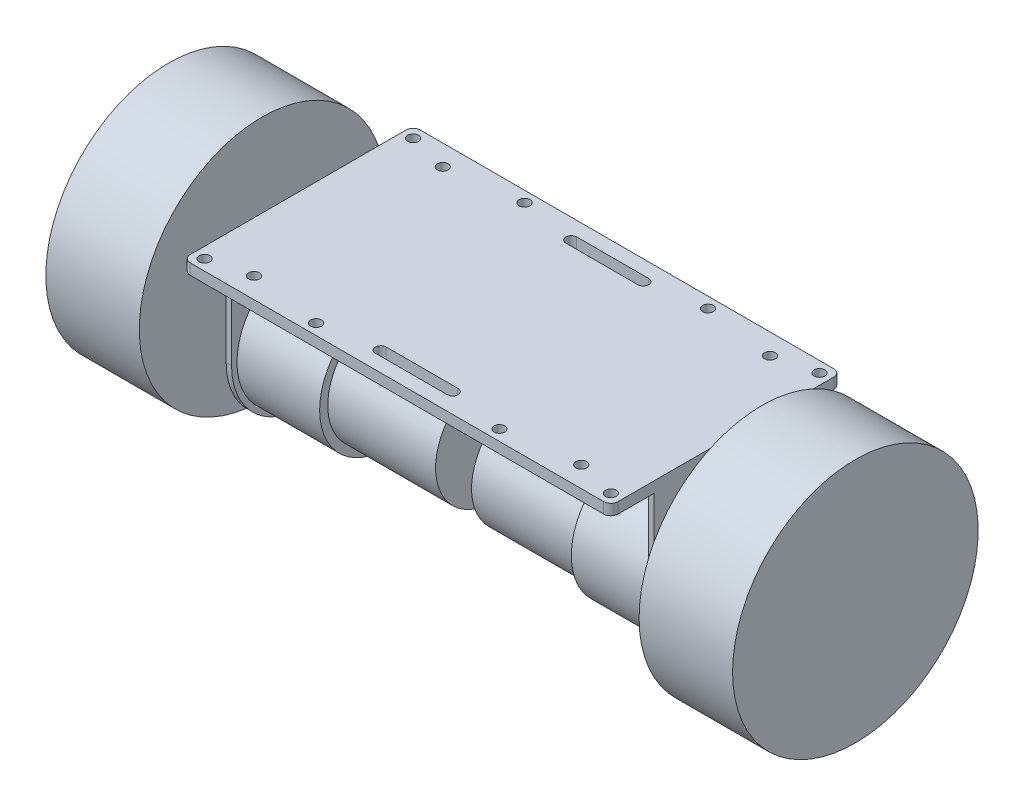
from build123d import *

# Parameters (mm, degrees)
SKETCH2_R           = 1.5
BOSS_EXTRUDE1_DEPTH = 3
SKETCH4_W           = 1.5
SKETCH4_H           = 40
BOSS_EXTRUDE2_DEPTH = 48
CUT_EXTRUDE1_DEPTH  = 133.245982926
SKETCH6_R           = 18.5
BOSS_EXTRUDE3_DEPTH = 23
SKETCH7_R           = 16.25
BOSS_EXTRUDE4_DEPTH = 30
SKETCH8_R           = 6
BOSS_EXTRUDE5_DEPTH = 10
SKETCH9_R           = 34.15
BOSS_EXTRUDE6_DEPTH = 26


with BuildPart() as part:
    # Sketch2 → Boss-Extrude1 (new body)
    with BuildSketch(Plane(origin=(0, 0, 0), x_dir=(1, 0, 0), z_dir=(0, 1, 0))):
        with BuildLine():
            Line((57.5, -32), (-57.5, -32))
            ThreePointArc((-57.5, -32), (-58.914213562, -31.414213562), (-59.5, -30))
            Line((-59.5, -30), (-59.5, 30))
            ThreePointArc((-59.5, 30), (-58.914213562, 31.414213562), (-57.5, 32))
            Line((-57.5, 32), (57.5, 32))
            ThreePointArc((57.5, 32), (58.914213562, 31.414213562), (59.5, 30))
            Line((59.5, 30), (59.5, -30))
            ThreePointArc((59.5, -30), (58.914213562, -31.414213562), (57.5, -32))
        make_face()
        with Locations((-56.5, 29)):
            Circle(SKETCH2_R, mode=Mode.SUBTRACT)
        with Locations((-45.5, 26.25)):
            Circle(SKETCH2_R, mode=Mode.SUBTRACT)
        with Locations((-25.5, 29)):
            Circle(SKETCH2_R, mode=Mode.SUBTRACT)
        with Locations((-25.5, -29)):
            Circle(SKETCH2_R, mode=Mode.SUBTRACT)
        with Locations((-45.5, -26.25)):
            Circle(SKETCH2_R, mode=Mode.SUBTRACT)
        with Locations((-56.5, -29)):
            Circle(SKETCH2_R, mode=Mode.SUBTRACT)
        with Locations((25.5, -29)):
            Circle(SKETCH2_R, mode=Mode.SUBTRACT)
        with Locations((45.5, -26.25)):
            Circle(SKETCH2_R, mode=Mode.SUBTRACT)
        with Locations((56.5, -29)):
            Circle(SKETCH2_R, mode=Mode.SUBTRACT)
        with Locations((56.5, 29)):
            Circle(SKETCH2_R, mode=Mode.SUBTRACT)
        with Locations((45.5, 26.25)):
            Circle(SKETCH2_R, mode=Mode.SUBTRACT)
        with Locations((25.5, 29)):
            Circle(SKETCH2_R, mode=Mode.SUBTRACT)
        with BuildLine():
            Line((10, 28), (-10, 28))
            ThreePointArc((-10, 28), (-11.5, 26.5), (-10, 25))
            Line((-10, 25), (10, 25))
            ThreePointArc((10, 25), (11.5, 26.5), (10, 28))
        make_face(mode=Mode.SUBTRACT)
        with BuildLine():
            Line((-10, -25), (10, -25))
            ThreePointArc((10, -25), (11.5, -26.5), (10, -28))
            Line((10, -28), (-10, -28))
            ThreePointArc((-10, -28), (-11.5, -26.5), (-10, -25))
        make_face(mode=Mode.SUBTRACT)
    extrude(amount=BOSS_EXTRUDE1_DEPTH)

    # Sketch4 → Boss-Extrude2 (add)
    with BuildSketch(Plane.XZ):
        with Locations((-58.75, 0)):
            Rectangle(SKETCH4_W, SKETCH4_H)
    boss_extrude2 = extrude(amount=BOSS_EXTRUDE2_DEPTH)

    # Mirror3: Boss-Extrude2 across plane
    add(boss_extrude2.mirror(Plane(origin=(0, 0, 0), x_dir=(0, 0, 1), z_dir=(1, 0, 0))))

    # Sketch5 → Cut-Extrude1 (cut, through all)
    with BuildSketch(Plane.ZY.offset(59.5)):
        with BuildLine():
            ThreePointArc((-1.66e-07, -48), (-14.142135683, -42.142135565), (-20, -28))
            Line((-20, -28), (-20, -48))
            Line((-20, -48), (-1.66e-07, -48))
        make_face()
        with BuildLine():
            ThreePointArc((20, -28), (14.142135565, -42.142135683), (-1.66e-07, -48))
            Line((-1.66e-07, -48), (20, -48))
            Line((20, -48), (20, -28))
        make_face()
    extrude(amount=-CUT_EXTRUDE1_DEPTH, mode=Mode.SUBTRACT)

    # Sketch6 → Boss-Extrude3 (add)
    with BuildSketch(Plane(origin=(-58, 0, 0), x_dir=(0, 0, -1), z_dir=(1, 0, 0))):
        with Locations((0, -28)):
            Circle(SKETCH6_R)
    boss_extrude3 = extrude(amount=BOSS_EXTRUDE3_DEPTH)

    # Sketch7 → Boss-Extrude4 (add)
    with BuildSketch(Plane(origin=(-35, 0, 0), x_dir=(0, 0, -1), z_dir=(1, 0, 0))):
        with Locations((0, -28)):
            Circle(SKETCH7_R)
    boss_extrude4 = extrude(amount=BOSS_EXTRUDE4_DEPTH)

    # Sketch8 → Boss-Extrude5 (add)
    with BuildSketch(Plane.ZY.offset(59.5)):
        with Locations((0, -18)):
            Circle(SKETCH8_R)
    boss_extrude5 = extrude(amount=BOSS_EXTRUDE5_DEPTH)

    # Sketch9 → Boss-Extrude6 (add)
    with BuildSketch(Plane.ZY.offset(69.5)):
        with Locations((0, -18)):
            Circle(SKETCH9_R)
    boss_extrude6 = extrude(amount=BOSS_EXTRUDE6_DEPTH)

    # Mirror7: Boss-Extrude3, Boss-Extrude4, Boss-Extrude5, Boss-Extrude6 across plane
    add(boss_extrude3.mirror(Plane(origin=(0, 0, 0), x_dir=(0, 0, 1), z_dir=(1, 0, 0))))
    add(boss_extrude4.mirror(Plane(origin=(0, 0, 0), x_dir=(0, 0, 1), z_dir=(1, 0, 0))))
    add(boss_extrude5.mirror(Plane(origin=(0, 0, 0), x_dir=(0, 0, 1), z_dir=(1, 0, 0))))
    add(boss_extrude6.mirror(Plane(origin=(0, 0, 0), x_dir=(0, 0, 1), z_dir=(1, 0, 0))))


solid = part.part
